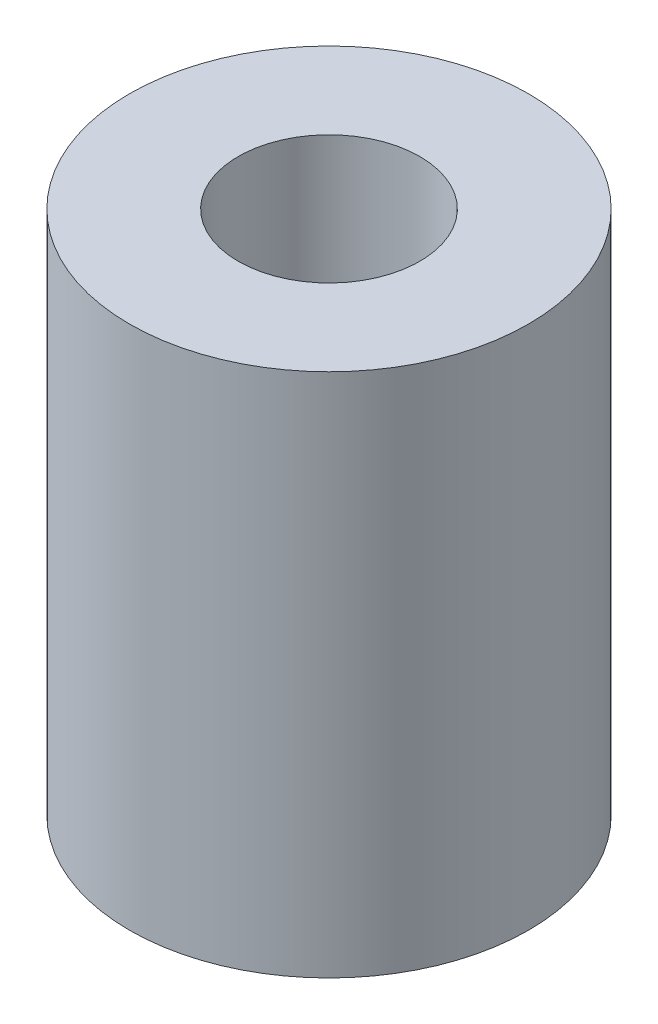
from build123d import *

# Parameters (mm, degrees)
SKETCH1_R           = 2.413
SKETCH1_R_2         = 1.098320384
BOSS_EXTRUDE1_DEPTH = 6.35


with BuildPart() as part:
    # Sketch1 → Boss-Extrude1 (new body)
    with BuildSketch(Plane(origin=(0, 0, 0), x_dir=(1, 0, 0), z_dir=(0, 1, 0))):
        Circle(SKETCH1_R)
        Circle(SKETCH1_R_2, mode=Mode.SUBTRACT)
    extrude(amount=BOSS_EXTRUDE1_DEPTH)


solid = part.part
